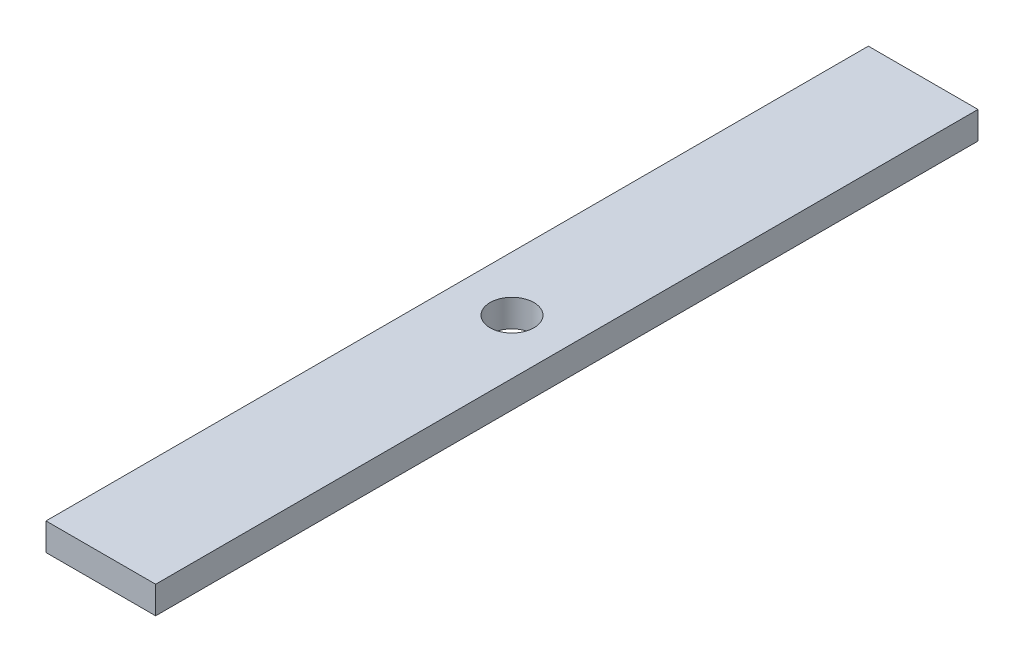
from build123d import *

# Parameters (mm, degrees)
SKETCH1_W                       = 20
SKETCH1_H                       = 5
BOSS_EXTRUDE1_DEPTH             = 106
SKETCH2_R                       = 4
HOLES_FOR_20MM_STRIP_ONLY_DEPTH = 107.587991819
SKETCH5_OUTSIDE_W               = 64.6
SKETCH5_OUTSIDE_H               = 256.6
SKETCH5_OUTSIDE_W_2             = 51.505008444
SKETCH5_OUTSIDE_H_2             = 150
CUT_EXTRUDE3_DEPTH              = 107.587991819


with BuildPart() as part:
    # Sketch1 → Boss-Extrude1 (new, symmetric)
    with BuildSketch(Plane.XY):
        Rectangle(SKETCH1_W, SKETCH1_H)
    extrude(amount=BOSS_EXTRUDE1_DEPTH, both=True)

    # Sketch2 → Holes for 20mm strip ONLY (cut, through all)
    with BuildSketch(Plane(origin=(0, 2.5, 0), x_dir=(1, 0, 0), z_dir=(0, 1, 0))):
        with Locations((0, 87.5)):
            Circle(SKETCH2_R)
        Circle(SKETCH2_R)
        with Locations((0, -87.5)):
            Circle(SKETCH2_R)
    extrude(amount=-HOLES_FOR_20MM_STRIP_ONLY_DEPTH, mode=Mode.SUBTRACT)

    # Sketch5 outside → Cut-Extrude3 (cut, through all)
    with BuildSketch(Plane(origin=(0, 2.5, 0), x_dir=(1, 0, 0), z_dir=(0, 1, 0))):
        Rectangle(SKETCH5_OUTSIDE_W, SKETCH5_OUTSIDE_H)
        Rectangle(SKETCH5_OUTSIDE_W_2, SKETCH5_OUTSIDE_H_2, mode=Mode.SUBTRACT)
    extrude(amount=-CUT_EXTRUDE3_DEPTH, mode=Mode.SUBTRACT)


solid = part.part
